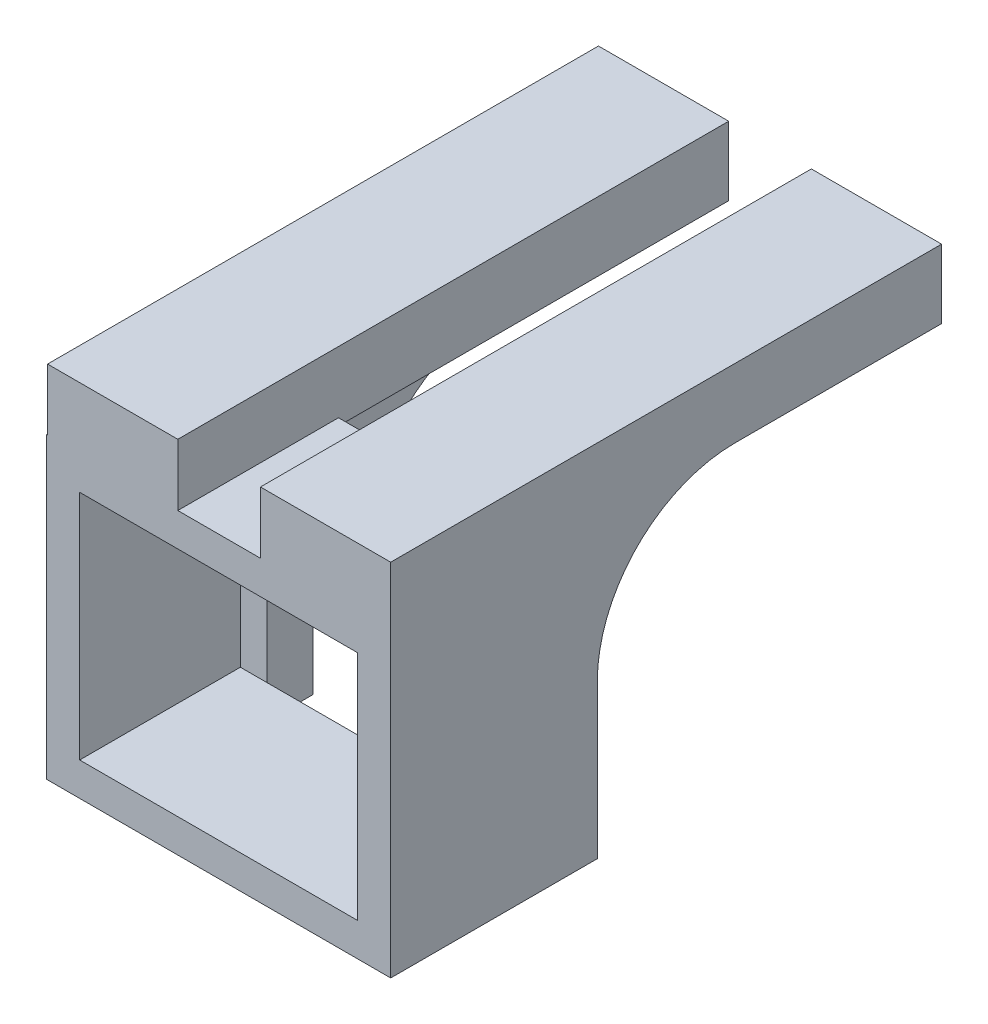
from build123d import *

# Parameters (mm, degrees)
SKETCH1_W                = 15
SKETCH1_H                = 13
SKETCH1_W_2              = 12.1
SKETCH1_H_2              = 10.1
BOSS_EXTRUDE1_DEPTH      = 7
BOSS_EXTRUDE2_DEPTH      = 17
BOSS_EXTRUDE2_DEPTH_BACK = 7
SKETCH2_W                = 5.674885541
SKETCH2_H                = 3
BOSS_EXTRUDE3_DEPTH      = 2
FILLET1_START            = -4.744281145
FILLET1_DEPTH            = 3.685449278
FILLET1_START_2          = 7.64136832
FILLET1_2_DEPTH          = 2.564121617
FILLET1_START_3          = 5.430604396
FILLET1_3_DEPTH          = 2.210763824
FILLET1_START_4          = -1.058831867
FILLET1_4_DEPTH          = 1.089436263
FILLET1_START_5          = -8
FILLET1_5_DEPTH          = 6


with BuildPart() as part:
    # Sketch1 → Boss-Extrude1 (new body)
    with BuildSketch(Plane.XY):
        with Locations((2.705489937, 9.533064254)):
            Rectangle(SKETCH1_W, SKETCH1_H)
        with Locations((2.705489937, 9.533064254)):
            Rectangle(SKETCH1_W_2, SKETCH1_H_2, mode=Mode.SUBTRACT)
    extrude(amount=BOSS_EXTRUDE1_DEPTH)

    # Sketch2 → Boss-Extrude2 (add, two sides: drawn at the far end of the back side and taken through both)
    with BuildSketch(Plane(origin=(0, 0, 0), x_dir=(-1, 0, 0), z_dir=(0, 0, -1)).offset(-BOSS_EXTRUDE2_DEPTH_BACK)):
        with Locations((-7.368047167, 17.22155756)):
            Rectangle(SKETCH2_W, SKETCH2_H)
        with Locations((1.906838375, 17.22155756)):
            Rectangle(SKETCH2_W, SKETCH2_H)
    extrude(amount=BOSS_EXTRUDE2_DEPTH + BOSS_EXTRUDE2_DEPTH_BACK)

    # Sketch3 → Boss-Extrude3 (add)
    with BuildSketch(Plane(origin=(0, 0, 0), x_dir=(-1, 0, 0), z_dir=(0, 0, -1))):
        with BuildLine():
            Line((-10.205489937, 15.72155756), (-5.430604396, 15.72155756))
            Line((-5.430604396, 15.72155756), (-5.430604396, 13.72345972))
            ThreePointArc((-5.430604396, 13.72345972), (-7.053489061, 11.951422257), (-7.64136822, 9.62155756))
            Line((-7.64136822, 9.62155756), (-7.64136822, 3.033064254))
            Line((-7.64136822, 3.033064254), (-10.205489937, 3.033064254))
            Line((-10.205489937, 3.033064254), (-10.205489937, 9.62155756))
            Line((-10.205489937, 9.62155756), (-10.205489937, 13.72345972))
            Line((-10.205489937, 13.72345972), (-10.205489937, 15.72155756))
        make_face()
        with BuildLine():
            Line((4.744281145, 15.72155756), (4.744281145, 13.72345972))
            Line((4.744281145, 13.72345972), (4.744281145, 9.62155756))
            Line((4.744281145, 9.62155756), (4.744281145, 3.033064254))
            Line((4.744281145, 3.033064254), (2.180159427, 3.033064254))
            Line((2.180159427, 3.033064254), (2.180159427, 9.62155756))
            ThreePointArc((2.180159427, 9.62155756), (1.592280269, 11.951422257), (-0.030604396, 13.72345972))
            Line((-0.030604396, 13.72345972), (-0.030604396, 15.72155756))
            Line((-0.030604396, 15.72155756), (4.744281145, 15.72155756))
        make_face()
    extrude(amount=BOSS_EXTRUDE3_DEPTH)

    # Fillet1: read off the stored shape, not the designer's step
    # Fillet1 outline → Fillet1 (add)
    with BuildSketch(Plane.YZ.offset(FILLET1_START)):
        with BuildLine():
            ThreePointArc((9.72155756, -2), (13.964198247, -3.757359313), (15.72155756, -8))
            Line((15.72155756, -8), (15.72155756, -2))
            Line((15.72155756, -2), (9.72155756, -2))
        make_face()
    extrude(amount=FILLET1_DEPTH)

    # Fillet1 2 outline → Fillet1 2 (add)
    with BuildSketch(Plane.YZ.offset(FILLET1_START_2)):
        with BuildLine():
            ThreePointArc((9.72155756, -2), (13.964198247, -3.757359313), (15.72155756, -8))
            Line((15.72155756, -8), (15.72155756, -2))
            Line((15.72155756, -2), (9.72155756, -2))
        make_face()
    extrude(amount=FILLET1_2_DEPTH)

    # Fillet1 3 outline → Fillet1 3 (add)
    with BuildSketch(Plane.YZ.offset(FILLET1_START_3)):
        with BuildLine():
            ThreePointArc((9.72155756, -2), (13.964198247, -3.757359313), (15.72155756, -8))
            Line((15.72155756, -8), (15.72155756, -2))
            Line((15.72155756, -2), (9.72155756, -2))
        make_face()
    extrude(amount=FILLET1_3_DEPTH)

    # Fillet1 4 outline → Fillet1 4 (add)
    with BuildSketch(Plane.YZ.offset(FILLET1_START_4)):
        with BuildLine():
            ThreePointArc((9.72155756, -2), (13.964198247, -3.757359313), (15.72155756, -8))
            Line((15.72155756, -8), (15.72155756, -2))
            Line((15.72155756, -2), (9.72155756, -2))
        make_face()
    extrude(amount=FILLET1_4_DEPTH)

    # Fillet1 5 outline → Fillet1 5 (cut)
    with BuildSketch(Plane.XY.offset(FILLET1_START_5)):
        with BuildLine():
            Line((7.64136822, 8), (7.64136822, 9.62155756))
            ThreePointArc((7.64136822, 9.62155756), (7.053489061, 11.951422256), (5.430604396, 13.72345972))
            Line((5.430604396, 13.72345972), (5.430604396, 8))
            Line((5.430604396, 8), (7.64136822, 8))
        make_face()
        with BuildLine():
            Line((-2.180159426, 8), (0.030604396, 8))
            Line((0.030604396, 8), (0.030604396, 13.72345972))
            ThreePointArc((0.030604396, 13.72345972), (-1.592280269, 11.951422257), (-2.180159427, 9.62155756))
            Line((-2.180159427, 9.62155756), (-2.180159426, 8))
        make_face()
    extrude(amount=FILLET1_5_DEPTH, mode=Mode.SUBTRACT)


solid = part.part
